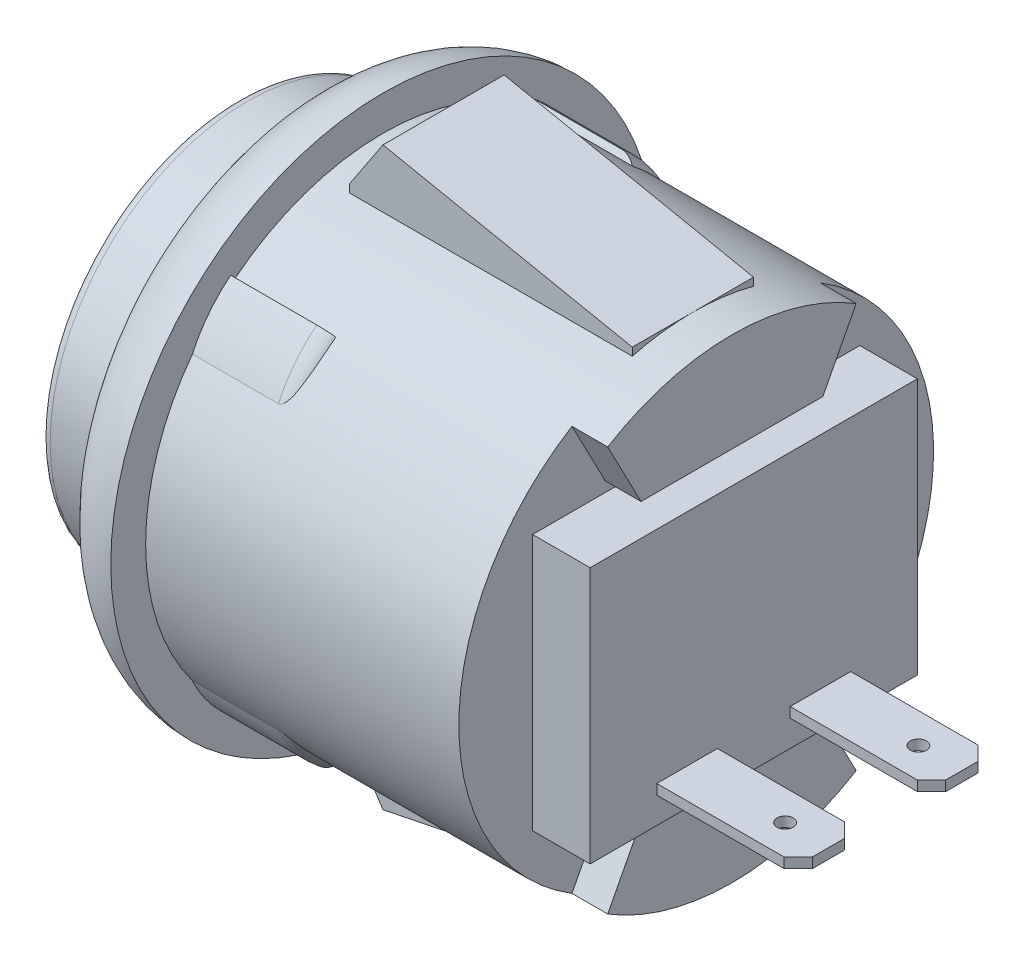
from build123d import *

# Parameters (mm, degrees)
BOSS_EXTRUDE4_START = 5.26
BOSS_EXTRUDE4_DEPTH = 5.26
FILLET2_R           = 1
SKETCH8_OUTSIDE_W   = 38.012
SKETCH8_OUTSIDE_H   = 38.012
CUT_EXTRUDE2_DEPTH  = 1.77
BOSS_EXTRUDE1_DEPTH = 2.85
SKETCH3_W           = 3.0000000000000004
SKETCH3_H           = 0.5
SKETCH3_W_2         = 3.000000000000001
BOSS_EXTRUDE2_DEPTH = 7
SKETCH4_R           = 0.40000000000000124
CUT_EXTRUDE1_DEPTH  = 40.59712936066199
CHAMFER1_SIZE       = 0.7
BOSS_EXTRUDE3_DEPTH = 3
FILLET1_R           = 0.5


with BuildPart() as part:
    # Sketch1 → Revolve1 (revolve)
    with BuildSketch(Plane.XY, mode=Mode.PRIVATE) as revolve1_sk:
        with BuildLine():
            Line((0, 0), (0, 9.75))
            Line((0, 9.75), (3.4999999999999996, 9.749999999999998))
            ThreePointArc((3.4999999999999996, 9.749999999999998), (4.591027240080107, 12.383972759919889), (7.224999999999997, 13.474999999999998))
            Line((7.224999999999997, 13.474999999999998), (7.224999999999998, 11.75))
            Line((7.224999999999998, 11.75), (24.5, 11.75))
            Line((24.5, 11.75), (24.5, 0))
            Line((24.5, 0), (0, 0))
        make_face()
    revolve(revolve1_sk.sketch.rotate(Axis((24.5, 0, 0), (-1, 0, 0)), 90), axis=Axis((24.5, 0, 0), (-1, 0, 0)))

    # Sketch7 → Boss-Extrude4 (add)
    with BuildSketch(Plane(origin=(7.224999999999997, 0, 0), x_dir=(0, 0, -1), z_dir=(1, 0, 0)).offset(BOSS_EXTRUDE4_START)):
        with BuildLine():
            Line((-7.337277205884233, 9.177519447215122), (-7.540223171153369, 9.431365729797664))
            ThreePointArc((-7.540223171153369, 9.431365729797664), (-8.631515815707116, 8.327069376529131), (-9.437293044088438, 7))
            ThreePointArc((-9.437293044088438, 7), (-8.457656265394512, 8.156626171183342), (-7.337277205884233, 9.177519447215122))
        make_face()
        with BuildLine():
            Line((-7.337277205884229, -9.177519447215122), (-7.540223171153365, -9.431365729797664))
            ThreePointArc((-7.540223171153365, -9.431365729797664), (-8.631515815707113, -8.327069376529131), (-9.437293044088431, -7))
            ThreePointArc((-9.437293044088431, -7), (-8.457656265394512, -8.15662617118334), (-7.337277205884229, -9.177519447215122))
        make_face()
        with BuildLine():
            Line((7.337277205884229, -9.177519447215122), (7.540223171153365, -9.431365729797664))
            ThreePointArc((7.540223171153365, -9.431365729797664), (8.631515815707113, -8.327069376529131), (9.437293044088431, -7))
            ThreePointArc((9.437293044088431, -7), (8.45765626539451, -8.156626171183342), (7.337277205884229, -9.177519447215122))
        make_face()
        with BuildLine():
            Line((7.337277205884233, 9.177519447215122), (7.540223171153369, 9.431365729797664))
            ThreePointArc((7.540223171153369, 9.431365729797664), (8.631515815707118, 8.32706937652913), (9.437293044088438, 7))
            ThreePointArc((9.437293044088438, 7), (8.457656265394514, 8.15662617118334), (7.337277205884233, 9.177519447215122))
        make_face()
    extrude(amount=-BOSS_EXTRUDE4_DEPTH)

    # Fillet2
    # the kernel refuses this fillet: 1 mm, written as the material it takes off along each edge
    with BuildSketch(Plane(origin=(12.484999999999996, -4.232653152686616, 3.383937203973504), x_dir=(0, -0.9556882368173963, 0.2943806957136558), z_dir=(0, -0.2943806957136558, -0.9556882368173963))) as fillet2_piece_1_section:
        with BuildLine():
            CenterArc((6.655924090642022 - FILLET2_R, FILLET2_R), FILLET2_R, 270, 90)
            Line((6.655924090642022 - FILLET2_R, 0), (6.655924090642022, 0))
            Line((6.655924090642022, 0), (6.6559240906420225, FILLET2_R))
        make_face()
    fillet2_piece_1 = revolve(axis=Axis((12.484999999999996, -4.232653152686616, 3.383937203973504), (-1, 0, 0)), revolution_arc=69.83301403972071, mode=Mode.PRIVATE)
    fillet2_piece_1 = fillet2_piece_1 - Plane(origin=(12.185339920044097, 0, 0), x_dir=(0, 1.1e-16, -1), z_dir=(1, 0, 0)) * Cylinder(11.75, 27, mode=Mode.PRIVATE)
    add(fillet2_piece_1, mode=Mode.SUBTRACT)
    with BuildSketch(Plane(origin=(12.484999999999996, -4.232653152686616, -3.383937203973504), x_dir=(0, -0.9556882368173963, -0.2943806957136558), z_dir=(0, -0.2943806957136558, 0.9556882368173963))) as fillet2_piece_2_section:
        with BuildLine():
            CenterArc((6.655924090642022 - FILLET2_R, -FILLET2_R), FILLET2_R, 0, 90)
            Line((6.655924090642022 - FILLET2_R, 0), (6.655924090642022, 0))
            Line((6.655924090642022, 0), (6.6559240906420225, -FILLET2_R))
        make_face()
    fillet2_piece_2 = revolve(axis=Axis((12.484999999999996, -4.232653152686616, -3.383937203973504), (1, 0, 0)), revolution_arc=69.83301403972071, mode=Mode.PRIVATE)
    fillet2_piece_2 = fillet2_piece_2 - Plane(origin=(12.185339900483468, 0, 0), x_dir=(0, 1.1e-16, -1), z_dir=(1, 0, 0)) * Cylinder(11.75, 27, mode=Mode.PRIVATE)
    add(fillet2_piece_2, mode=Mode.SUBTRACT)
    with BuildSketch(Plane(origin=(12.484999999999996, 4.2326531526865825, -3.383937203973474), x_dir=(0, 0.9556882368173955, -0.29438069571365894), z_dir=(0, 0.29438069571365894, 0.9556882368173955))) as fillet2_piece_3_section:
        with BuildLine():
            CenterArc((6.65592409064207 - FILLET2_R, FILLET2_R), FILLET2_R, 270, 90)
            Line((6.65592409064207 - FILLET2_R, 0), (6.65592409064207, 0))
            Line((6.65592409064207, 0), (6.65592409064207, FILLET2_R))
        make_face()
    fillet2_piece_3 = revolve(axis=Axis((12.484999999999996, 4.2326531526865825, -3.383937203973474), (-1, 0, 0)), revolution_arc=69.83301403972023, mode=Mode.PRIVATE)
    fillet2_piece_3 = fillet2_piece_3 - Plane(origin=(12.185339920045562, 0, 0), x_dir=(0, 1.1e-16, -1), z_dir=(1, 0, 0)) * Cylinder(11.75, 27, mode=Mode.PRIVATE)
    add(fillet2_piece_3, mode=Mode.SUBTRACT)
    with BuildSketch(Plane(origin=(12.484999999999996, 4.232653152686593, 3.3839372039734887), x_dir=(0, 0.955688236817396, 0.29438069571365705), z_dir=(0, 0.29438069571365705, -0.955688236817396))) as fillet2_piece_4_section:
        with BuildLine():
            CenterArc((6.65592409064205 - FILLET2_R, -FILLET2_R), FILLET2_R, 0, 89.99999999999994)
            Line((6.65592409064205 - FILLET2_R, 0), (6.65592409064205, 0))
            Line((6.65592409064205, 0), (6.655924090642049, -FILLET2_R))
        make_face()
    fillet2_piece_4 = revolve(axis=Axis((12.484999999999996, 4.232653152686593, 3.3839372039734887), (1, 0, 0)), revolution_arc=69.83301403972044, mode=Mode.PRIVATE)
    fillet2_piece_4 = fillet2_piece_4 - Plane(origin=(12.185339900321193, 0, 0), x_dir=(0, 1.1e-16, -1), z_dir=(1, 0, 0)) * Cylinder(11.75, 27, mode=Mode.PRIVATE)
    add(fillet2_piece_4, mode=Mode.SUBTRACT)

    # Sketch8 outside → Cut-Extrude2 (cut)
    with BuildSketch(Plane(origin=(24.5, 0, 0), x_dir=(0, 0, -1), z_dir=(1, 0, 0))):
        Rectangle(SKETCH8_OUTSIDE_W, SKETCH8_OUTSIDE_H)
        with BuildLine():
            Line((-6.1499999999999995, 10.011992808627065), (-4.5, 6.85))
            Line((-4.5, 6.85), (4.5, 6.85))
            Line((4.5, 6.85), (6.1499999999999995, 10.011992808627065))
            ThreePointArc((6.1499999999999995, 10.011992808627065), (7.2e-16, 11.750000000000002), (-6.1499999999999995, 10.011992808627065))
        make_face(mode=Mode.SUBTRACT)
        with BuildLine():
            Line((4.5, -6.85), (6.1499999999999995, -10.011992808627065))
            ThreePointArc((6.1499999999999995, -10.011992808627065), (7.2e-16, -11.750000000000002), (-6.1499999999999995, -10.011992808627065))
            Line((-6.1499999999999995, -10.011992808627065), (-4.5, -6.85))
            Line((-4.5, -6.85), (4.5, -6.85))
        make_face(mode=Mode.SUBTRACT)
    extrude(amount=-CUT_EXTRUDE2_DEPTH, mode=Mode.SUBTRACT)

    # Sketch2 → Boss-Extrude1 (add)
    with BuildSketch(Plane(origin=(22.73, 0, 0), x_dir=(0, 0, -1), z_dir=(1, 0, 0))):
        Polygon((-8.100000000000001, 6.35), (8.099999999999998, 6.35), (8.1, -6.35), (-8.1, -6.35), align=None)
    extrude(amount=BOSS_EXTRUDE1_DEPTH)

    # Sketch3 → Boss-Extrude2 (add)
    with BuildSketch(Plane(origin=(25.58, 0, 0), x_dir=(0, 0, -1), z_dir=(1, 0, 0))):
        with Locations((-3.3, -4.8)):
            Rectangle(SKETCH3_W, SKETCH3_H)
        with Locations((3.300000000000001, -4.799999999999999)):
            Rectangle(SKETCH3_W_2, SKETCH3_H)
    extrude(amount=BOSS_EXTRUDE2_DEPTH)

    # Sketch4 → Cut-Extrude1 (cut, through all)
    with BuildSketch(Plane(origin=(0, -4.55, 0), x_dir=(-1, 0, 0), z_dir=(0, 1, -6e-17))):
        with Locations(Location((-30.43, 3.2999999999999994, 0), (0, 0, 90))):
            Circle(SKETCH4_R)
        with Locations(Location((-30.43, -3.3000000000000007, 0), (0, 0, 90))):
            Circle(SKETCH4_R)
    extrude(amount=-CUT_EXTRUDE1_DEPTH, mode=Mode.SUBTRACT)

    # Chamfer1
    chamfer1_edges = [part.edges().sort_by_distance(p)[0] for p in [
        (32.58, -4.8, 1.7999999999999996),
        (32.58, -4.8, 4.8),
        (32.58, -4.799999999999999, -4.800000000000002),
        (32.58, -4.799999999999999, -1.8000000000000007),
    ]]
    chamfer(chamfer1_edges, length=CHAMFER1_SIZE)

    # Sketch5 → Boss-Extrude3 (add, symmetric)
    with BuildSketch(Plane.XY):
        Polygon((22.56668760482229, -11.75), (10.224999999999994, -14.25), (8.566687604822294, -11.750000000000002), (8.566687604822294, -10.750000000000002), (22.56668760482229, -10.75), align=None)
        Polygon((8.56668760482229, 10.750000000000005), (8.56668760482229, 11.750000000000005), (10.22499999999999, 14.250000000000004), (22.566687604822288, 11.750000000000007), (22.566687604822288, 10.750000000000007), align=None)
    extrude(amount=BOSS_EXTRUDE3_DEPTH, both=True)

    # Fillet1
    fillet1_edges = [part.edges().sort_by_distance(p)[0] for p in [
        (0, -2.28e-15, 9.75),
    ]]
    fillet(fillet1_edges, radius=FILLET1_R)


solid = part.part
